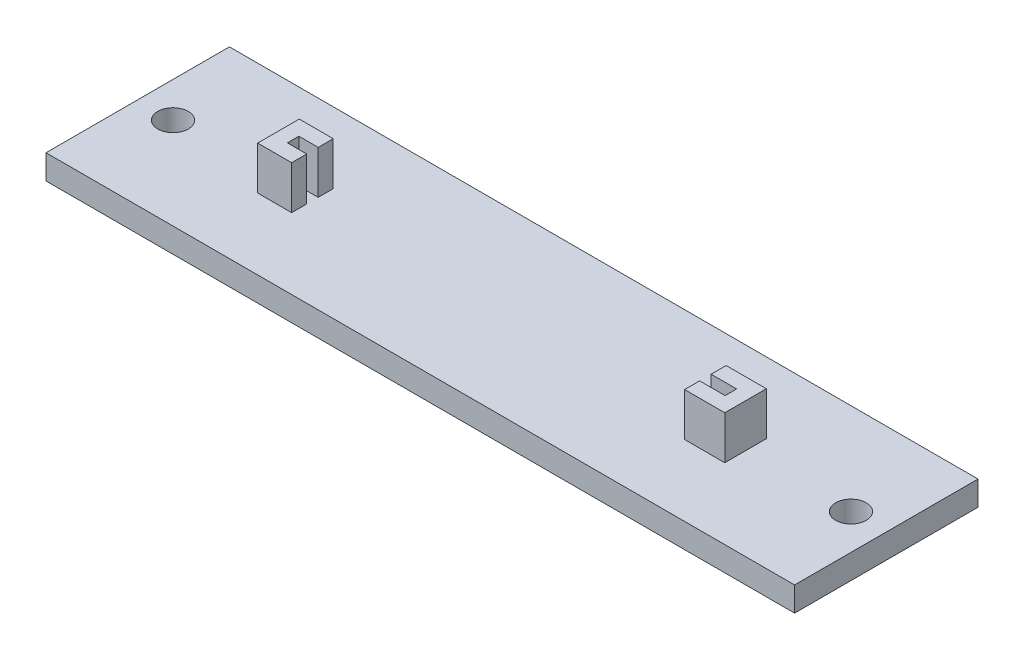
from build123d import *

# Parameters (mm, degrees)
SKETCH1_W           = 77.75
SKETCH1_H           = 19.05
BOSS_EXTRUDE1_DEPTH = 2.54
SKETCH2_R           = 1.5875
CUT_EXTRUDE1_DEPTH  = 41.105396769
SKETCH3_W           = 48.514
SKETCH3_H           = 4.318
BOSS_EXTRUDE2_DEPTH = 4.4958
SKETCH4_W           = 45.466
SKETCH4_H           = 1.1938
CUT_EXTRUDE2_DEPTH  = 4.4958
SKETCH6_W           = 40.810788913
SKETCH6_H           = 1.5621
CUT_EXTRUDE3_DEPTH  = 4.4958


with BuildPart() as part:
    # Sketch1 → Boss-Extrude1 (new body)
    with BuildSketch(Plane(origin=(0, 0, 0), x_dir=(1, 0, 0), z_dir=(0, 1, 0))):
        Rectangle(SKETCH1_W, SKETCH1_H)
    extrude(amount=BOSS_EXTRUDE1_DEPTH)

    # Sketch2 → Cut-Extrude1 (cut, through all)
    with BuildSketch(Plane(origin=(0, 2.54, 0), x_dir=(1, 0, 0), z_dir=(0, 1, 0))):
        with Locations((35.2047, 0)):
            Circle(SKETCH2_R)
        with Locations((-35.2047, 0)):
            Circle(SKETCH2_R)
    extrude(amount=-CUT_EXTRUDE1_DEPTH, mode=Mode.SUBTRACT)

    # Sketch3 → Boss-Extrude2 (add)
    with BuildSketch(Plane(origin=(0, 2.54, 0), x_dir=(1, 0, 0), z_dir=(0, 1, 0))):
        Rectangle(SKETCH3_W, SKETCH3_H)
    extrude(amount=BOSS_EXTRUDE2_DEPTH)

    # Sketch4 → Cut-Extrude2 (cut)
    with BuildSketch(Plane(origin=(0, 7.0358, 0), x_dir=(1, 0, 0), z_dir=(0, 1, 0))):
        Rectangle(SKETCH4_W, SKETCH4_H)
    extrude(amount=-CUT_EXTRUDE2_DEPTH, mode=Mode.SUBTRACT)

    # Sketch6 → Cut-Extrude3 (cut)
    with BuildSketch(Plane(origin=(0, 7.0358, 0), x_dir=(1, 0, 0), z_dir=(0, 1, 0))):
        with Locations((-0.321005544, -1.37795)):
            Rectangle(SKETCH6_W, SKETCH6_H)
        with Locations((-0.321005544, 1.37795)):
            Rectangle(SKETCH6_W, SKETCH6_H)
    extrude(amount=-CUT_EXTRUDE3_DEPTH, mode=Mode.SUBTRACT)


solid = part.part
